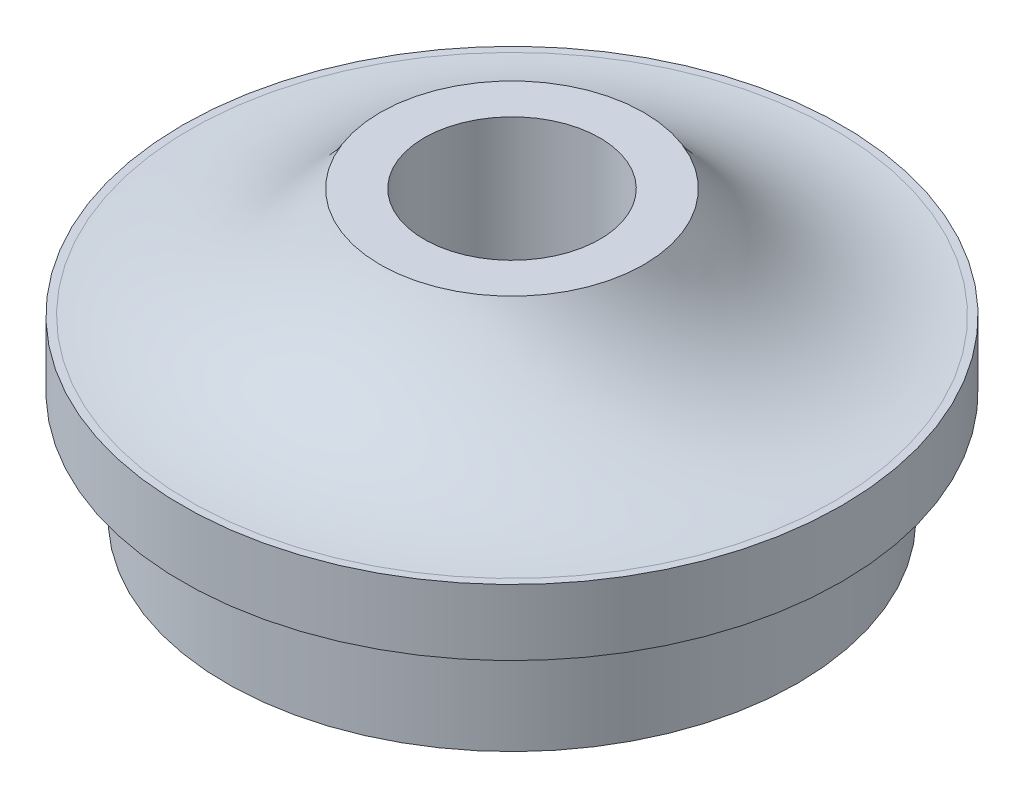
from build123d import *

# Parameters (mm, degrees)
SKETCH_2_R          = 6
EXTRUDE_1_DEPTH     = 5
FILLET_2_R          = 10
SKETCH_3_R          = 4
CUT_EXTRUDE_1_DEPTH = 18


with BuildPart() as part:
    # 草图1 → 旋转1 (revolve)
    with BuildSketch(Plane.XY, mode=Mode.PRIVATE) as revolve_1_sk:
        Polygon((0, 0), (-13, 0), (-13, 5), (-15, 5), (-15, 8), (0, 8), align=None)
    revolve(revolve_1_sk.sketch.rotate(Axis((0, -267.914485955, 0), (0, 1, 0)), 180), axis=Axis((0, -267.914485955, 0), (0, 1, 0)))

    # 草图2 → 凸台-拉伸1 (add)
    with BuildSketch(Plane(origin=(0, 8, 0), x_dir=(1, 0, 0), z_dir=(0, 1, 0))):
        with Locations(Location((0, 0, 0), (0, 0, 180))):
            Circle(SKETCH_2_R)
    extrude(amount=EXTRUDE_1_DEPTH)

    # 圆角2
    # the kernel refuses this fillet: 10 mm, written as the material it adds along each edge
    with BuildSketch(Plane(origin=(0, 8, 0), x_dir=(-1, 0, 0), z_dir=(0, 0, -1))) as fillet_2_piece_1:
        with BuildLine():
            CenterArc((14.660254038, 10), FILLET_2_R, 210, 60)
            Line((6, 5), (6, 0))
            Line((6, 0), (14.660254038, 0))
        make_face()
    revolve(axis=Axis((0, 8, 0), (0, 1, 0)))

    # 草图3 → 切除-拉伸1 (cut)
    with BuildSketch(Plane(origin=(0, 13, 0), x_dir=(1, 0, 0), z_dir=(0, 1, 0))):
        with Locations(Location((0, 0, 0), (0, 0, 180))):
            Circle(SKETCH_3_R)
    extrude(amount=-CUT_EXTRUDE_1_DEPTH, mode=Mode.SUBTRACT)


solid = part.part
